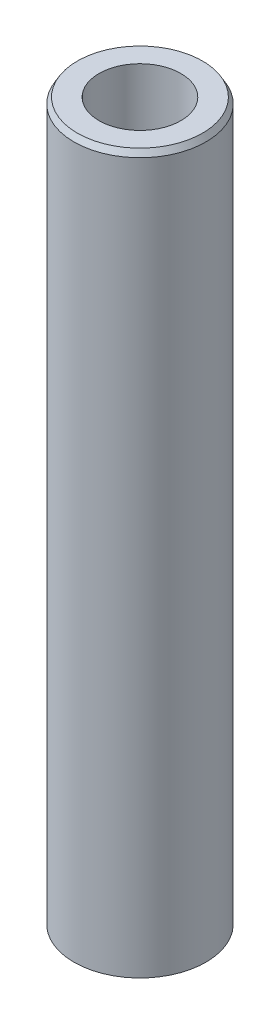
from build123d import *
from OCP.BRepFilletAPI import BRepFilletAPI_MakeChamfer

# Parameters (mm, degrees)
SKETCH1_R           = 55
BOSS_EXTRUDE1_DEPTH = 600
SKETCH2_R           = 34.109051912
CUT_EXTRUDE1_DEPTH  = 606.020660804
CHAMFER1_SIZE       = 4.922522526
CHAMFER1_SIZE2      = 2.842019705


with BuildPart() as part:
    # Sketch1 → Boss-Extrude1 (new body)
    with BuildSketch(Plane(origin=(0, 0, 0), x_dir=(1, 0, 0), z_dir=(0, 1, 0))):
        Circle(SKETCH1_R)
    extrude(amount=BOSS_EXTRUDE1_DEPTH)

    # Sketch2 → Cut-Extrude1 (cut, through all)
    with BuildSketch(Plane(origin=(0, 0, 0), x_dir=(1, 0, 0), z_dir=(0, 1, 0))):
        Circle(SKETCH2_R)
    extrude(amount=CUT_EXTRUDE1_DEPTH, mode=Mode.SUBTRACT)

    # Chamfer1: one chamfer whose edges measure the first distance from different faces: ONE call of the kernel's chamfer builder (chamfer() names one face for all edges)
    chamfer1_edges_1 = [part.edges().sort_by_distance(p)[0] for p in [
        (-55, 600, 0),
    ]]
    chamfer1_side_1 = [part.faces().sort_by_distance(p)[0] for p in [
        (-55, 300, 0),
    ]]
    chamfer1_edges_2 = [part.edges().sort_by_distance(p)[0] for p in [
        (-55, 0, 0),
    ]]
    chamfer1_side_2 = [part.faces().sort_by_distance(p)[0] for p in [
        (-53.444365081, 0, 0),
    ]]
    chamfer1 = BRepFilletAPI_MakeChamfer(part.part.solid().wrapped)
    for e in chamfer1_edges_1:
        chamfer1.Add(CHAMFER1_SIZE, CHAMFER1_SIZE2, e.wrapped, chamfer1_side_1[0].wrapped)  # the first distance lies on this face
    for e in chamfer1_edges_2:
        chamfer1.Add(CHAMFER1_SIZE, CHAMFER1_SIZE2, e.wrapped, chamfer1_side_2[0].wrapped)  # the first distance lies on this face
    add(Compound.cast(chamfer1.Shape()), mode=Mode.REPLACE)


solid = part.part
